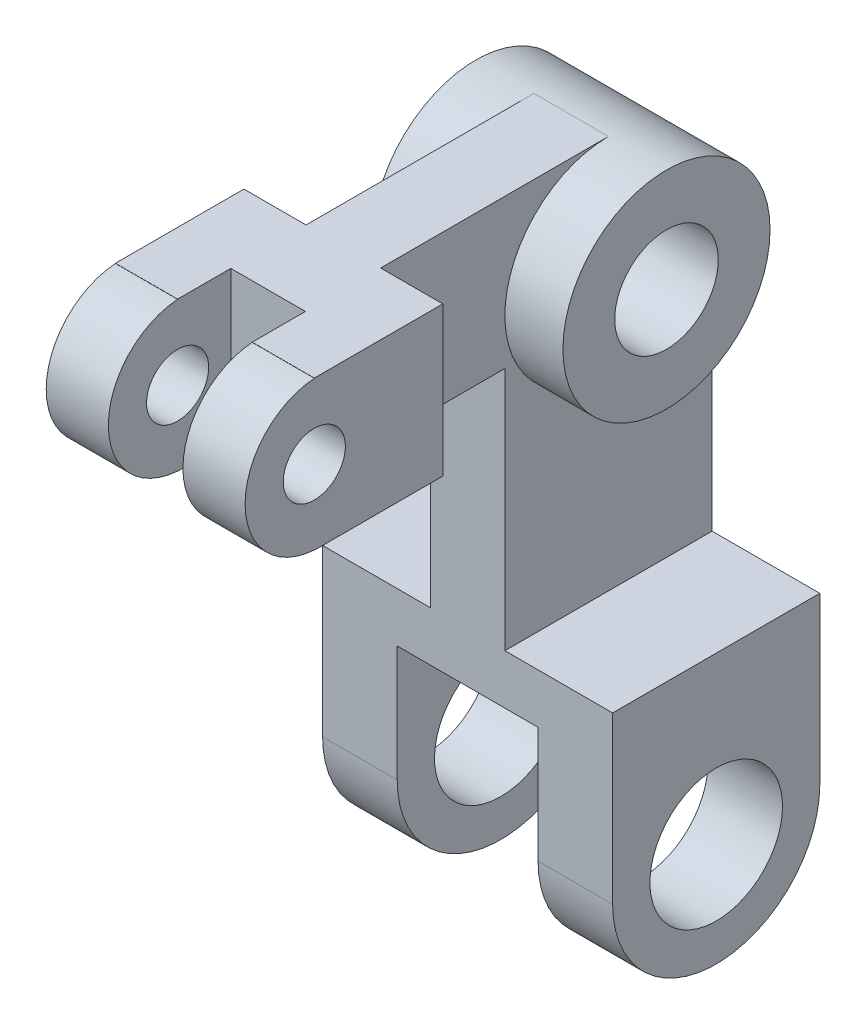
from build123d import *

# Parameters (mm, degrees)
ESBO_O1_R                = 7.5
RESSALTO_EXTRUS_O1_DEPTH = 24
RESSALTO_EXTRUS_O2_DEPTH = 9
ESBO_O1_4_R              = 12.5
RESSALTO_EXTRUS_O3_DEPTH = 23
ESBO_O1_5_R              = 16
RESSALTO_EXTRUS_O4_DEPTH = 35
ESBO_O2_W                = 34
ESBO_O2_H                = 66.30992931
CORTE_EXTRUS_O1_DEPTH    = 70
ESBO_O3_W                = 48
ESBO_O3_H                = 36
RESSALTO_EXTRUS_O7_DEPTH = 31
ESBO_O4_R                = 7.5
CORTE_EXTRUS_O2_DEPTH    = 48.5
ESBO_O5_W                = 18
ESBO_O5_H                = 36.287513413
CORTE_EXTRUS_O3_DEPTH    = 189


with BuildPart() as part:
    # Esboço1 → Ressalto-extrusão1 (new, symmetric)
    with BuildSketch(Plane(origin=(0, 0, 0), x_dir=(0, 0, -1), z_dir=(1, 0, 0))):
        with BuildLine():
            ThreePointArc((-66.711274338, 117), (-71.983352277, 129.727922061), (-84.711274338, 135))
            ThreePointArc((-84.711274338, 135), (-102.711274338, 117), (-84.711274338, 99))
            ThreePointArc((-84.711274338, 99), (-71.983352277, 104.272077939), (-66.711274338, 117))
        make_face()
        with Locations((-84.711274338, 117)):
            Circle(ESBO_O1_R, mode=Mode.SUBTRACT)
    extrude(amount=RESSALTO_EXTRUS_O1_DEPTH, both=True)

    # Esboço1<3> → Ressalto-extrusão2 (add, symmetric)
    with BuildSketch(Plane(origin=(0, 0, 0), x_dir=(0, 0, -1), z_dir=(1, 0, 0))):
        with BuildLine():
            Line((0, 135), (-84.711274338, 135))
            ThreePointArc((-84.711274338, 135), (-71.983352277, 129.727922061), (-66.711274338, 117))
            ThreePointArc((-66.711274338, 117), (-71.983352277, 104.272077939), (-84.711274338, 99))
            Line((-84.711274338, 99), (-25, 99))
            Line((-25, 99), (-25, 40))
            Line((-25, 40), (25, 40))
            Line((25, 40), (25, 110))
            ThreePointArc((25, 110), (-17.67766953, 92.32233047), (0, 135))
        make_face()
    extrude(amount=RESSALTO_EXTRUS_O2_DEPTH, both=True)

    # Esboço1<4> → Ressalto-extrusão3 (add, symmetric)
    with BuildSketch(Plane(origin=(0, 0, 0), x_dir=(0, 0, -1), z_dir=(1, 0, 0))):
        with BuildLine():
            ThreePointArc((25, 110), (17.67766953, 127.67766953), (0, 135))
            ThreePointArc((0, 135), (-17.67766953, 92.32233047), (25, 110))
        make_face()
        with Locations((0, 110)):
            Circle(ESBO_O1_4_R, mode=Mode.SUBTRACT)
    extrude(amount=RESSALTO_EXTRUS_O3_DEPTH, both=True)

    # Esboço1<5> → Ressalto-extrusão4 (add, symmetric)
    with BuildSketch(Plane(origin=(0, 0, 0), x_dir=(0, 0, -1), z_dir=(1, 0, 0))):
        with BuildLine():
            Line((25, 0), (25, 40))
            Line((25, 40), (-25, 40))
            Line((-25, 40), (-25, 0))
            ThreePointArc((-25, 0), (0, -25), (25, 0))
        make_face()
        Circle(ESBO_O1_5_R, mode=Mode.SUBTRACT)
    extrude(amount=RESSALTO_EXTRUS_O4_DEPTH, both=True)

    # Esboço2 → Corte-extrusão1 (cut, symmetric)
    with BuildSketch(Plane.XY):
        with Locations((0, -5.154964655)):
            Rectangle(ESBO_O2_W, ESBO_O2_H)
    extrude(amount=CORTE_EXTRUS_O1_DEPTH, both=True, mode=Mode.SUBTRACT)

    # Esboço3 → Ressalto-extrusão7 (add)
    with BuildSketch(Plane.XY.offset(55)):
        with Locations((0, 117)):
            Rectangle(ESBO_O3_W, ESBO_O3_H)
    extrude(amount=RESSALTO_EXTRUS_O7_DEPTH)

    # Esboço4 → Corte-extrusão2 (cut, symmetric)
    with BuildSketch(Plane(origin=(0, 0, 0), x_dir=(0, 0, -1), z_dir=(1, 0, 0))):
        with Locations((-86, 117)):
            Circle(ESBO_O4_R)
    extrude(amount=CORTE_EXTRUS_O2_DEPTH, both=True, mode=Mode.SUBTRACT)

    # Esboço5 → Corte-extrusão3 (cut)
    with BuildSketch(Plane(origin=(0, 0, 0), x_dir=(1, 0, 0), z_dir=(0, 1, 0))):
        with Locations((0, -91.305048631)):
            Rectangle(ESBO_O5_W, ESBO_O5_H)
    extrude(amount=CORTE_EXTRUS_O3_DEPTH, mode=Mode.SUBTRACT)


solid = part.part
